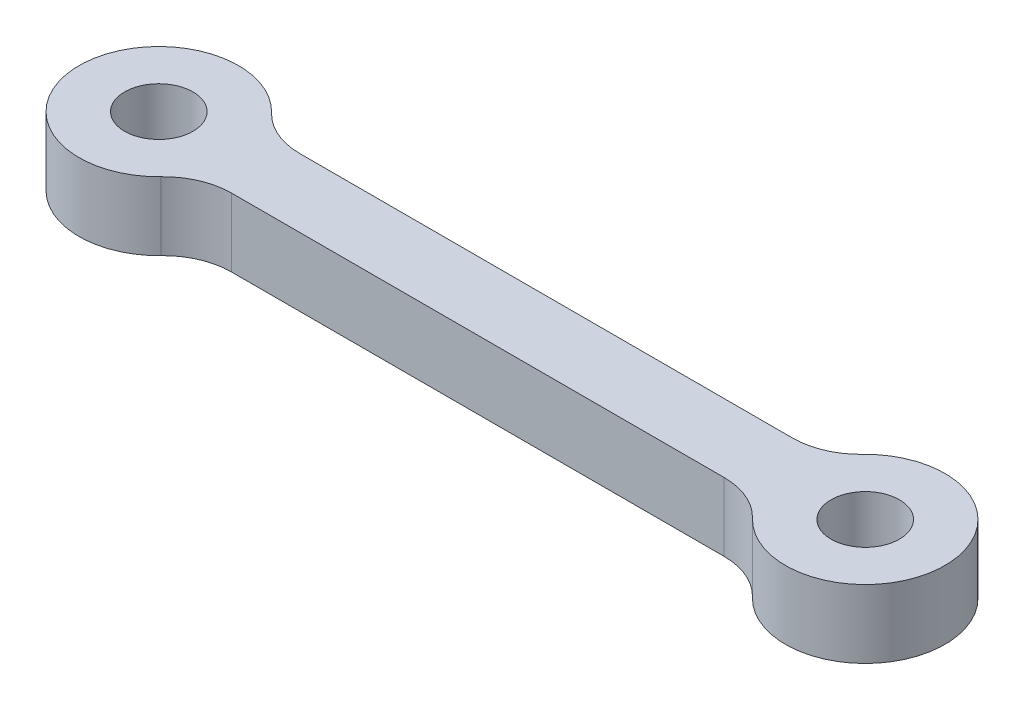
from build123d import *

# Parameters (mm, degrees)
SKETCH1_R           = 1.5
BOSS_EXTRUDE1_DEPTH = 3
FILLET1_R           = 3


with BuildPart() as part:
    # Sketch1 → Boss-Extrude1 (new body)
    with BuildSketch(Plane(origin=(0, 0, 0), x_dir=(1, 0, 0), z_dir=(0, 1, 0))):
        with BuildLine():
            ThreePointArc((3.16227766, 1.5), (-3.5, 0), (3.16227766, -1.5))
            Line((3.16227766, -1.5), (27.83772234, -1.5))
            ThreePointArc((27.83772234, -1.5), (34.5, 0), (27.83772234, 1.5))
            Line((27.83772234, 1.5), (3.16227766, 1.5))
        make_face()
        Circle(SKETCH1_R, mode=Mode.SUBTRACT)
        with Locations((31, 0)):
            Circle(SKETCH1_R, mode=Mode.SUBTRACT)
    extrude(amount=BOSS_EXTRUDE1_DEPTH)

    # Fillet1
    fillet1_edges = [part.edges().sort_by_distance(p)[0] for p in [
        (3.16227766, 1.5, 1.5),
        (27.83772234, 1.5, 1.5),
        (27.83772234, 1.5, -1.5),
        (3.16227766, 1.5, -1.5),
    ]]
    fillet(fillet1_edges, radius=FILLET1_R)


solid = part.part
